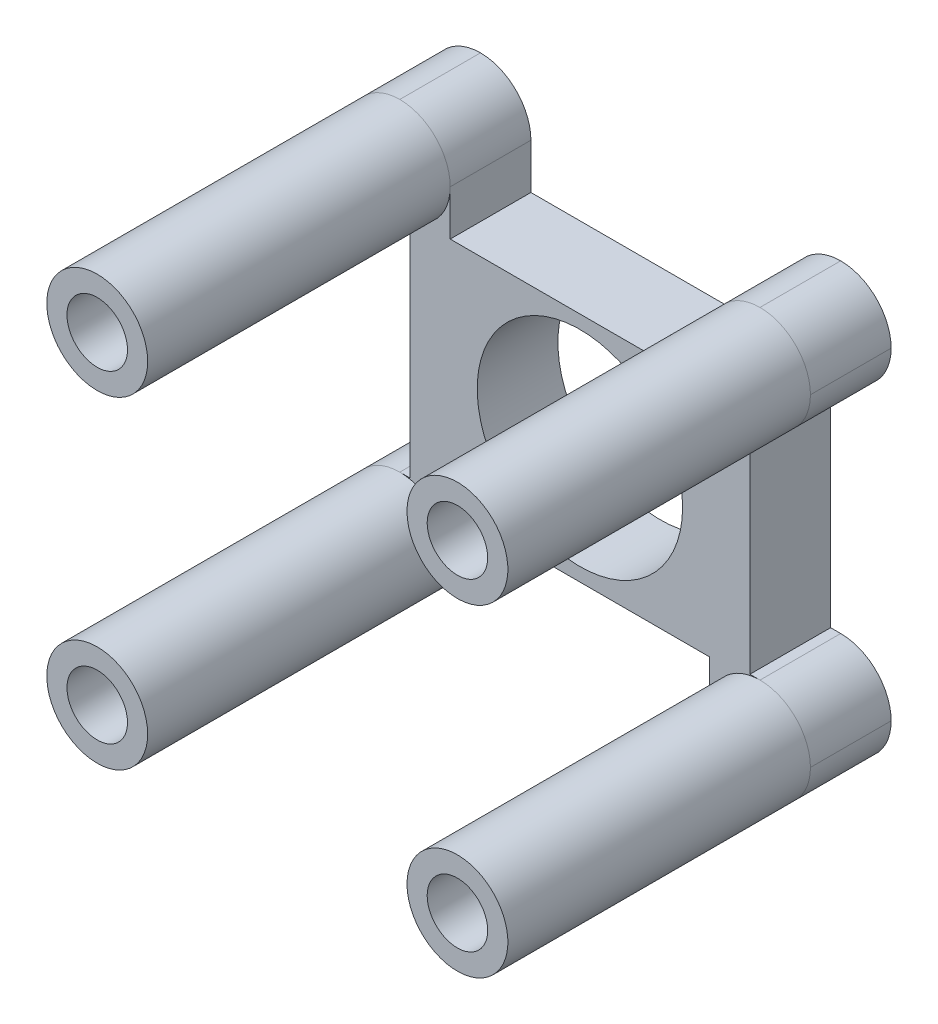
from build123d import *

# Parameters (mm, degrees)
SKETCH1_W                 = 5
SKETCH1_H                 = 21
SKETCH1_W_2               = 12.857156358
SKETCH1_H_2               = 11.510722094
SKETCH1_R                 = 5.090892781
BOSS_EXTRUDE3_DEPTH       = 4
SKETCH2_R                 = 2.5
SKETCH2_R_2               = 1.5
BOSS_EXTRUDE4_DEPTH       = 15
MIRROR2_COPY_1_SKETCH_R   = 2.5
MIRROR2_COPY_1_SKETCH_R_2 = 1.5
MIRROR2_COPY_1_DEPTH      = 15
FILLET1_R                 = 2.5
CUT_EXTRUDE1_REACH        = 23.584
SKETCH3_W                 = 3
SKETCH3_H                 = 11
FILLET2_R                 = 2.5
FILLET3_R                 = 2.5


with BuildPart() as part:
    # Sketch1 → Boss-Extrude3 (new body)
    # profile 1 of 3: a face of its own
    with BuildSketch(Plane.XY):
        with Locations((8.928578179, 0)):
            Rectangle(SKETCH1_W, SKETCH1_H)
    # profile 2 of 3: a face of its own
    with BuildSketch(Plane.XY):
        Rectangle(SKETCH1_W_2, SKETCH1_H_2)
        Circle(SKETCH1_R, mode=Mode.SUBTRACT)
    # profile 3 of 3: a face of its own
    with BuildSketch(Plane.XY):
        with Locations((-8.928578179, 0)):
            Rectangle(SKETCH1_W, SKETCH1_H)
    extrude(amount=BOSS_EXTRUDE3_DEPTH)

    # Sketch2 → Boss-Extrude4 (add)
    with BuildSketch(Plane.XY.offset(4)):
        with Locations((-8.928578179, 8)):
            Circle(SKETCH2_R)
        with Locations((-8.928578179, 8)):
            Circle(SKETCH2_R_2, mode=Mode.SUBTRACT)
    boss_extrude4 = extrude(amount=BOSS_EXTRUDE4_DEPTH)

    # Mirror1: Boss-Extrude4 across plane
    add(boss_extrude4.mirror(Plane(origin=(0, 0, 0), x_dir=(0, 0, 1), z_dir=(1, 0, 0))))

    # Mirror2: Boss-Extrude4 across plane
    add(boss_extrude4.mirror(Plane.ZX))

    # Mirror2 copy 1 sketch → Mirror2 copy 1 (add)
    with BuildSketch(Plane(origin=(0, 0, 4), x_dir=(-1, 0, 0), z_dir=(0, 0, 1))):
        with Locations((-8.928578179, 8)):
            Circle(MIRROR2_COPY_1_SKETCH_R)
        with Locations((-8.928578179, 8)):
            Circle(MIRROR2_COPY_1_SKETCH_R_2, mode=Mode.SUBTRACT)
    extrude(amount=MIRROR2_COPY_1_DEPTH)

    # Fillet1
    fillet1_edges = [part.edges().sort_by_distance(p)[0] for p in [
        (-11.428578179, 10.5, 2),
        (-11.428578179, -10.5, 2),
        (-6.428578179, -10.5, 2),
        (6.428578179, -10.5, 2),
        (11.428578179, -10.5, 2),
        (11.428578179, 10.5, 2),
        (6.428578179, 10.5, 2),
        (-6.428578179, 10.5, 2),
    ]]
    fillet(fillet1_edges, radius=FILLET1_R - 0.0001)  # a hair under: the kernel refuses the full size

    # Sketch3 → Cut-Extrude1 (cut, up to next)
    with BuildSketch(Plane.XY.offset(4), mode=Mode.PRIVATE) as cut_extrude1_sk1:
        with Locations((-9.928578179, 0)):
            Rectangle(SKETCH3_W, SKETCH3_H)
    cut_extrude1_tool1 = extrude(cut_extrude1_sk1.sketch, amount=-CUT_EXTRUDE1_REACH, mode=Mode.PRIVATE) & part.part
    cut_extrude1 = cut_extrude1_tool1.solids().sort_by_distance((-9.928578, 0, 4))[0]
    add(cut_extrude1, mode=Mode.SUBTRACT)

    # Fillet2
    fillet2_edges = [part.edges().sort_by_distance(p)[0] for p in [
        (-11.428578179, 5.5, 2),
    ]]
    fillet(fillet2_edges, radius=FILLET2_R)

    # Mirror3: Cut-Extrude1 across plane
    add(cut_extrude1.mirror(Plane(origin=(0, 0, 0), x_dir=(0, 0, 1), z_dir=(1, 0, 0))), mode=Mode.SUBTRACT)

    # Fillet3
    fillet3_edges = [part.edges().sort_by_distance(p)[0] for p in [
        (-11.428578179, -5.5, 2),
        (11.428578179, -5.5, 2),
        (11.428578179, 5.5, 2),
    ]]
    fillet(fillet3_edges, radius=FILLET3_R)


solid = part.part
